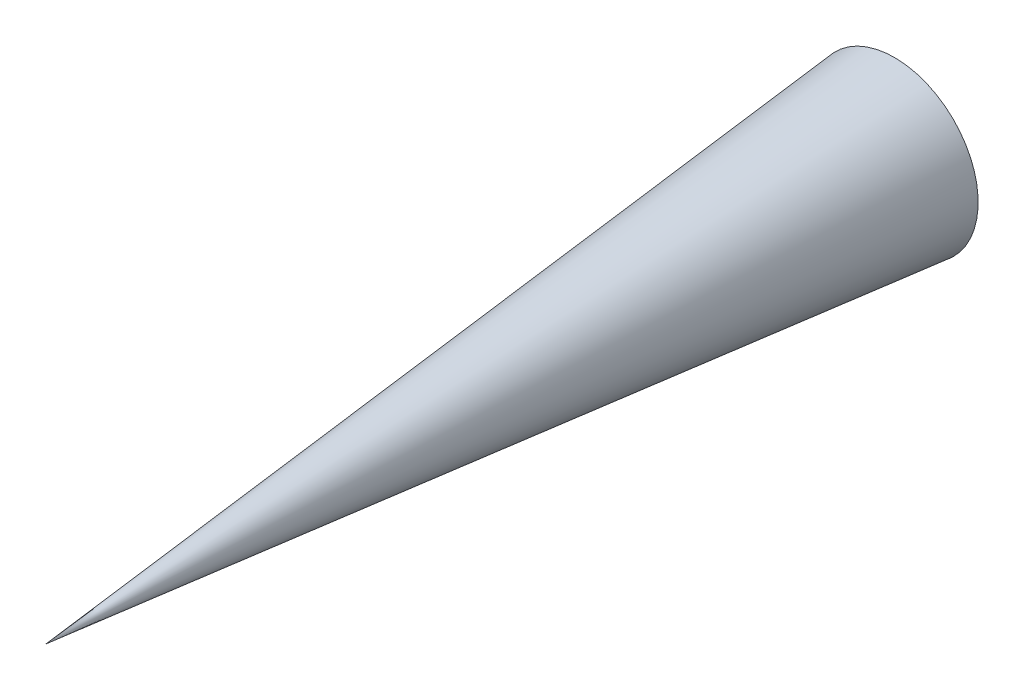
from build123d import *


with BuildPart() as part:
    # Sketch2 → Revolve1 (revolve)
    with BuildSketch(Plane(origin=(0, 0, 0), x_dir=(0, 0, -1), z_dir=(1, 0, 0))):
        with BuildLine():
            Line((0, 0), (0, 50.8))
            add(Edge.make_bspline(
                [(-515.43466696, 0), (-507.288117879, 0.802904267), (-491.124652277, 2.395936527), (-452.264197851, 6.225929369), (-422.796328148, 9.13021167), (-381.313054253, 13.218703285), (-351.44335661, 16.162588781), (-319.014018258, 19.358746304), (-291.829419681, 22.0379949), (-263.966154628, 24.78413123), (-237.038137035, 27.438091822), (-209.980153707, 30.104861524), (-186.020888084, 32.466229068), (-165.005703706, 34.537435051), (-146.041588122, 36.406492632), (-129.683525237, 38.018703932), (-112.79458612, 39.683237116), (-97.44062705, 41.196486361), (-80.427726051, 42.873236929), (-64.286234605, 44.46410347), (-43.499116183, 46.512831822), (-28.924939451, 47.949227597), (-10.367718231, 49.778182649), (-3.317599173, 50.473025412), (0, 50.8)],
                knots=[0.083402836, 0.083402836, 0.083402836, 0.083402836, 0.083402836, 0.146623644, 0.209844452, 0.269060323, 0.327990126, 0.382128307, 0.423250439, 0.467376275, 0.51064391, 0.558274066, 0.600254399, 0.640875914, 0.666550428, 0.694084377, 0.722691078, 0.74774578, 0.773897072, 0.796710916, 0.827510797, 0.861600449, 0.891685162, 0.917431193, 0.917431193, 0.917431193, 0.917431193, 0.917431193], degree=4))
            Line((-515.43466696, 0), (0, 0))
        make_face()
    revolve(axis=Axis((0, 0, 0), (0, 0, 1)))


solid = part.part
